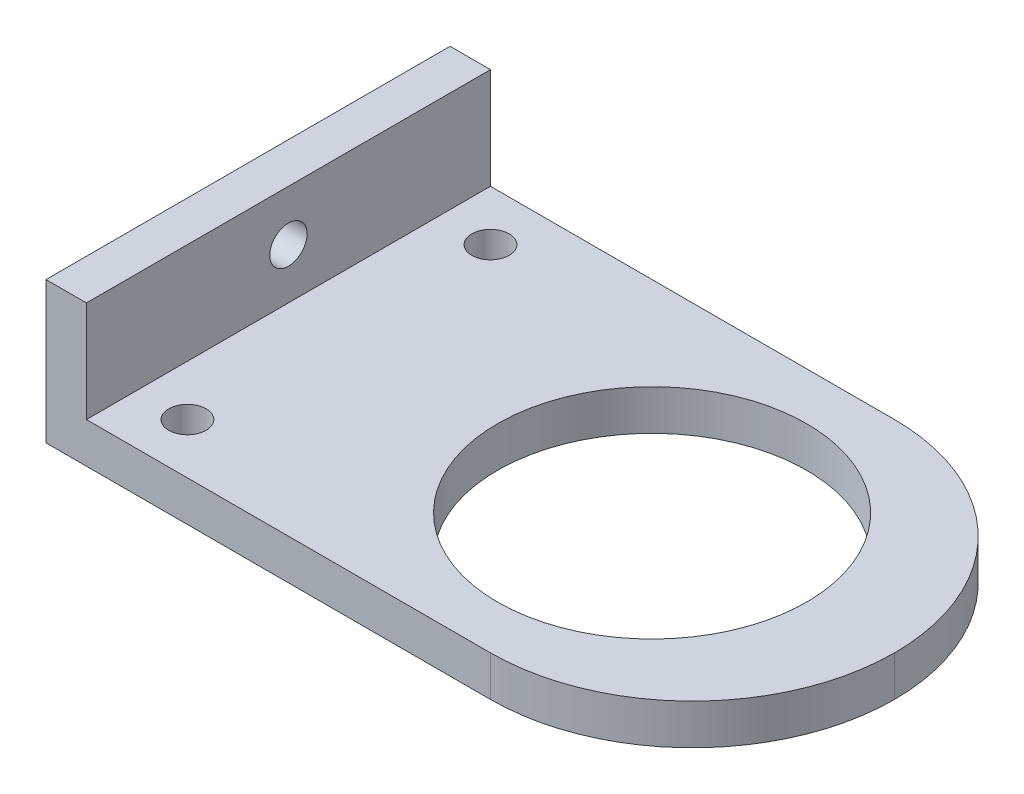
from build123d import *

# Parameters (mm, degrees)
EXTRUDE_1_DEPTH     = 40
SKETCH_2_R          = 1.85
CUT_EXTRUDE_1_DEPTH = 40
SKETCH_4_R          = 15.3
SKETCH_4_R_2        = 1.85
CUT_EXTRUDE_2_DEPTH = 40
FILLET_1_R          = 20


with BuildPart() as part:
    # ｽｹｯﾁ1 → ﾎﾞｽ - 押し出し1 (new body)
    with BuildSketch(Plane.XY):
        Polygon((0, 10), (0, 0), (60, 0), (60, -4), (-4, -4), (-4, 10), align=None)
    extrude(amount=EXTRUDE_1_DEPTH)

    # ｽｹｯﾁ2 → ｶｯﾄ - 押し出し1 (cut)
    with BuildSketch(Plane(origin=(0, 0, 0), x_dir=(0, 0, -1), z_dir=(1, 0, 0))):
        with Locations((-20, 5)):
            Circle(SKETCH_2_R)
    extrude(amount=-CUT_EXTRUDE_1_DEPTH, mode=Mode.SUBTRACT)

    # ｽｹｯﾁ4 → ｶｯﾄ - 押し出し2 (cut)
    with BuildSketch(Plane(origin=(0, 0, 0), x_dir=(1, 0, 0), z_dir=(0, 1, 0))):
        with Locations(Location((36, -20, 0), (0, 0, 270))):
            Circle(SKETCH_4_R)
        with Locations(Location((5, -5, 0), (0, 0, 270))):
            Circle(SKETCH_4_R_2)
        with Locations(Location((5, -35, 0), (0, 0, 270))):
            Circle(SKETCH_4_R_2)
    extrude(amount=-CUT_EXTRUDE_2_DEPTH, mode=Mode.SUBTRACT)

    # ﾌｨﾚｯﾄ1
    fillet_1_edges = [part.edges().sort_by_distance(p)[0] for p in [
        (60, -2, 0),
        (60, -2, 40),
    ]]
    fillet(fillet_1_edges, radius=FILLET_1_R - 0.0001)  # a hair under: the kernel refuses the full size


solid = part.part
